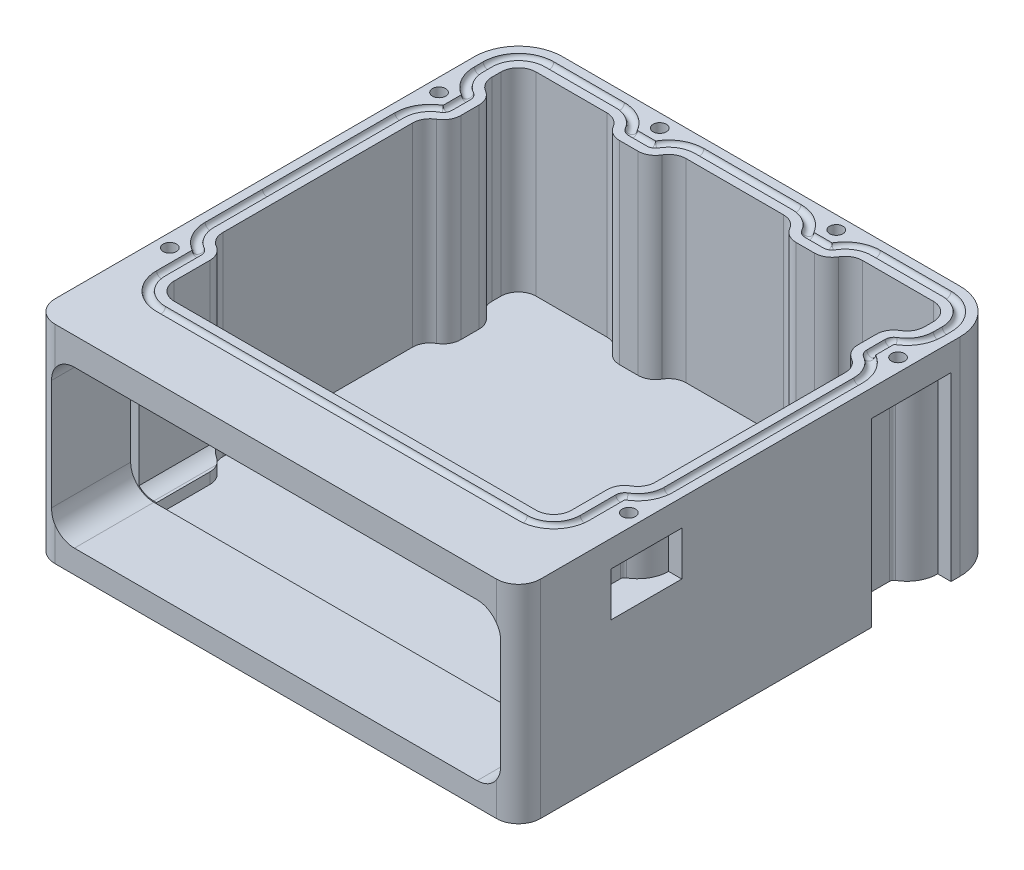
from build123d import *

# Parameters (mm, degrees)
EXTRUDE_THIN1_DEPTH      = 20
EXTRUDE_THIN1_DEPTH_BACK = 27
BOSS_EXTRUDE1_DEPTH      = 3
SKETCH4_W                = 104
SKETCH4_H                = 47
BOSS_EXTRUDE2_DEPTH      = 12
CUT_EXTRUDE1_DEPTH       = 18
SKETCH5_W                = 4
SKETCH5_H                = 15
SKETCH5_H_2              = 10
SKETCH5_W_2              = 10
SKETCH5_H_3              = 4
BOSS_EXTRUDE3_DEPTH      = 44
FILLET1_R                = 4
FILLET2_R                = 4
CUT_EXTRUDE2_DEPTH       = 10
SKETCH11_R               = 1.5
CUT_EXTRUDE3_DEPTH       = 231.447391
CUT_EXTRUDE6_REACH       = 230.88
SKETCH12_R               = 2.75
BOSS_EXTRUDE4_DEPTH      = 3
CUT_EXTRUDE4_START       = -18.9999
CUT_EXTRUDE4_DEPTH       = 18.9999
SKETCH6_R                = 1


with BuildPart() as part:
    # Sketch1 → Extrude-Thin1 (new, two sides: drawn at the far end of the back side and taken through both)
    with BuildSketch(Plane(origin=(0, 0, 0), x_dir=(1, 0, 0), z_dir=(0, 1, 0)).offset(-EXTRUDE_THIN1_DEPTH_BACK)):
        with BuildLine():
            Line((-55, 115), (-55, 210))
            ThreePointArc((-55, 210), (-52.071068, 217.071068), (-45, 220))
            Line((-45, 220), (45, 220))
            ThreePointArc((45, 220), (52.071068, 217.071068), (55, 210))
            Line((55, 210), (55, 115))
            ThreePointArc((55, 115), (53.535534, 111.464466), (50, 110))
            Line((50, 110), (-50, 110))
            ThreePointArc((-50, 110), (-53.535534, 111.464466), (-55, 115))
        make_face()
        with BuildLine():
            Line((-49, 116), (-49, 210))
            ThreePointArc((-49, 210), (-47.828427, 212.828427), (-45, 214))
            Line((-45, 214), (45, 214))
            ThreePointArc((45, 214), (47.828427, 212.828427), (49, 210))
            Line((49, 210), (49, 116))
            Line((49, 116), (-49, 116))
        make_face(mode=Mode.SUBTRACT)
    extrude(amount=EXTRUDE_THIN1_DEPTH + EXTRUDE_THIN1_DEPTH_BACK)

    # Sketch2 → Boss-Extrude1 (add)
    with BuildSketch(Plane.XZ.offset(27)):
        with BuildLine():
            Line((-49, -116), (49, -116))
            Line((49, -116), (49, -210))
            ThreePointArc((49, -210), (47.828427, -212.828427), (45, -214))
            Line((45, -214), (-45, -214))
            ThreePointArc((-45, -214), (-47.828427, -212.828427), (-49, -210))
            Line((-49, -210), (-49, -116))
        make_face()
    extrude(amount=-BOSS_EXTRUDE1_DEPTH)

    # Sketch4 → Boss-Extrude2 (add)
    with BuildSketch(Plane(origin=(0, 0, -116), x_dir=(-1, 0, 0), z_dir=(0, 0, -1))):
        with Locations((0, -3.5)):
            Rectangle(SKETCH4_W, SKETCH4_H)
    extrude(amount=BOSS_EXTRUDE2_DEPTH)

    # Sketch3 → Cut-Extrude1 (cut)
    with BuildSketch(Plane.XY.offset(-110)):
        with BuildLine():
            Line((-45.625, 13.75), (45.625, 13.75))
            ThreePointArc((45.625, 13.75), (49.337311, 12.212311), (50.875, 8.5))
            Line((50.875, 8.5), (50.875, -16.5))
            ThreePointArc((50.875, -16.5), (49.337311, -20.212311), (45.625, -21.75))
            Line((45.625, -21.75), (-45.625, -21.75))
            ThreePointArc((-45.625, -21.75), (-49.337311, -20.212311), (-50.875, -16.5))
            Line((-50.875, -16.5), (-50.875, 8.5))
            ThreePointArc((-50.875, 8.5), (-49.337311, 12.212311), (-45.625, 13.75))
        make_face()
    extrude(amount=-CUT_EXTRUDE1_DEPTH, mode=Mode.SUBTRACT)

    # Sketch5 → Boss-Extrude3 (add)
    with BuildSketch(Plane(origin=(0, -24, 0), x_dir=(1, 0, 0), z_dir=(0, 1, 0))):
        with Locations((47, 135.5)):
            Rectangle(SKETCH5_W, SKETCH5_H)
        with Locations((47, 199)):
            Rectangle(SKETCH5_W, SKETCH5_H_2)
        with Locations((20, 212)):
            Rectangle(SKETCH5_W_2, SKETCH5_H_3)
        with Locations((-20, 212)):
            Rectangle(SKETCH5_W_2, SKETCH5_H_3)
        with Locations((-47, 199)):
            Rectangle(SKETCH5_W, SKETCH5_H_2)
        with Locations((-47, 135.5)):
            Rectangle(SKETCH5_W, SKETCH5_H)
    extrude(amount=BOSS_EXTRUDE3_DEPTH)

    # Fillet1
    fillet1_edges = [part.edges().sort_by_distance(p)[0] for p in [
        (49, -2, -194),
        (49, -2, -204),
        (25, -2, -214),
        (15, -2, -214),
        (-15, -2, -214),
        (-25, -2, -214),
        (-49, -2, -204),
        (-49, -2, -194),
        (49, -2, -143),
        (-49, -2, -143),
    ]]
    fillet(fillet1_edges, radius=FILLET1_R - 0.0001)  # a hair under: the kernel refuses the full size

    # Fillet2
    fillet2_edges = [part.edges().sort_by_distance(p)[0] for p in [
        (45, 16.875, -128),
        (45, -2, -143),
        (45, -2, -194),
        (45, -2, -204),
        (25, -2, -210),
        (15, -2, -210),
        (-15, -2, -210),
        (-25, -2, -210),
        (-45, -2, -194),
        (-45, -2, -204),
        (-45, 16.875, -128),
        (-45, -2, -143),
    ]]
    fillet(fillet2_edges, radius=FILLET2_R)

    # Sketch10 → Cut-Extrude2 (cut)
    with BuildSketch(Plane(origin=(0, 14, 0), x_dir=(1, 0, 0), z_dir=(0, 1, 0))):
        with BuildLine():
            Line((-52, 147), (-55, 147))
            Line((-55, 147), (-55, 131))
            Line((-55, 131), (-50.5, 131))
            ThreePointArc((-50.5, 131), (-48.732233, 131.732233), (-48, 133.5))
            Line((-48, 133.5), (-48, 140.071797))
            ThreePointArc((-48, 140.071797), (-48.133975, 140.571797), (-48.5, 140.937822))
            ThreePointArc((-48.5, 140.937822), (-51.062178, 143.5), (-52, 147))
        make_face()
        with BuildLine():
            Line((52, 208), (55, 208))
            Line((55, 208), (55, 190))
            Line((55, 190), (52, 190))
            ThreePointArc((52, 190), (51.062178, 193.5), (48.5, 196.062178))
            ThreePointArc((48.5, 196.062178), (48.133975, 196.428203), (48, 196.928203))
            Line((48, 196.928203), (48, 201.071797))
            ThreePointArc((48, 201.071797), (48.133975, 201.571797), (48.5, 201.937822))
            ThreePointArc((48.5, 201.937822), (51.062178, 204.5), (52, 208))
        make_face()
        with BuildLine():
            Line((-29, 220), (-29, 217))
            ThreePointArc((-29, 217), (-25.5, 216.062178), (-22.937822, 213.5))
            ThreePointArc((-22.937822, 213.5), (-22.571797, 213.133975), (-22.071797, 213))
            Line((-22.071797, 213), (-17.928203, 213))
            ThreePointArc((-17.928203, 213), (-17.428203, 213.133975), (-17.062178, 213.5))
            ThreePointArc((-17.062178, 213.5), (-14.5, 216.062178), (-11, 217))
            Line((-11, 217), (-11, 220))
            Line((-11, 220), (-29, 220))
        make_face()
        with BuildLine():
            Line((-52, 208), (-55, 208))
            Line((-55, 208), (-55, 190))
            Line((-55, 190), (-52, 190))
            ThreePointArc((-52, 190), (-51.062178, 193.5), (-48.5, 196.062178))
            ThreePointArc((-48.5, 196.062178), (-48.133975, 196.428203), (-48, 196.928203))
            Line((-48, 196.928203), (-48, 201.071797))
            ThreePointArc((-48, 201.071797), (-48.133975, 201.571797), (-48.5, 201.937822))
            ThreePointArc((-48.5, 201.937822), (-51.062178, 204.5), (-52, 208))
        make_face()
        with BuildLine():
            Line((11, 220), (29, 220))
            Line((29, 220), (29, 217))
            ThreePointArc((29, 217), (25.5, 216.062178), (22.937822, 213.5))
            ThreePointArc((22.937822, 213.5), (22.571797, 213.133975), (22.071797, 213))
            Line((22.071797, 213), (17.928203, 213))
            ThreePointArc((17.928203, 213), (17.428203, 213.133975), (17.062178, 213.5))
            ThreePointArc((17.062178, 213.5), (14.5, 216.062178), (11, 217))
            Line((11, 217), (11, 220))
        make_face()
        with BuildLine():
            Line((48, 140.071797), (48, 133.5))
            ThreePointArc((48, 133.5), (48.732233, 131.732233), (50.5, 131))
            Line((50.5, 131), (55, 131))
            Line((55, 131), (55, 147))
            Line((55, 147), (52, 147))
            ThreePointArc((52, 147), (51.062178, 143.5), (48.5, 140.937822))
            ThreePointArc((48.5, 140.937822), (48.133975, 140.571797), (48, 140.071797))
        make_face()
    extrude(amount=-CUT_EXTRUDE2_DEPTH, mode=Mode.SUBTRACT)

    # Sketch11 → Cut-Extrude3 (cut, through all)
    with BuildSketch(Plane.XZ.offset(-14)):
        with Locations(Location((-52, -199, 0), (0, 0, 270))):
            Circle(SKETCH11_R)
        with Locations(Location((-20, -217.00298, 0), (0, 0, 270))):
            Circle(SKETCH11_R)
        with Locations(Location((20, -217.00298, 0), (0, 0, 270))):
            Circle(SKETCH11_R)
        with Locations(Location((52, -199, 0), (0, 0, 270))):
            Circle(SKETCH11_R)
        with Locations(Location((52, -138, 0), (0, 0, 270))):
            Circle(SKETCH11_R)
        with Locations(Location((-52, -138, 0), (0, 0, 270))):
            Circle(SKETCH11_R)
    extrude(amount=-CUT_EXTRUDE3_DEPTH, mode=Mode.SUBTRACT)

    # Sketch15 → Cut-Extrude6 (cut, up to next)
    with BuildSketch(Plane(origin=(0, 4, 0), x_dir=(1, 0, 0), z_dir=(0, 1, 0)), mode=Mode.PRIVATE) as cut_extrude6_sk1:
        with BuildLine():
            Line((-55, 208), (-55, 190))
            Line((-55, 190), (-52, 190))
            ThreePointArc((-52, 190), (-51.062178, 193.5), (-48.5, 196.062178))
            ThreePointArc((-48.5, 196.062178), (-48.133975, 196.428203), (-48, 196.928203))
            Line((-48, 196.928203), (-48, 201.071797))
            ThreePointArc((-48, 201.071797), (-48.133975, 201.571797), (-48.5, 201.937822))
            ThreePointArc((-48.5, 201.937822), (-51.062178, 204.5), (-52, 208))
            Line((-52, 208), (-55, 208))
        make_face()
    cut_extrude6_tool1 = extrude(cut_extrude6_sk1.sketch, amount=-CUT_EXTRUDE6_REACH, mode=Mode.PRIVATE) & part.part
    # Sketch15 → Cut-Extrude6 (cut, up to next)
    with BuildSketch(Plane(origin=(0, 4, 0), x_dir=(1, 0, 0), z_dir=(0, 1, 0)), mode=Mode.PRIVATE) as cut_extrude6_sk2:
        with BuildLine():
            Line((-11, 220), (-29, 220))
            Line((-29, 220), (-29, 217))
            ThreePointArc((-29, 217), (-25.5, 216.062178), (-22.937822, 213.5))
            ThreePointArc((-22.937822, 213.5), (-22.571797, 213.133975), (-22.071797, 213))
            Line((-22.071797, 213), (-17.928203, 213))
            ThreePointArc((-17.928203, 213), (-17.428203, 213.133975), (-17.062178, 213.5))
            ThreePointArc((-17.062178, 213.5), (-14.5, 216.062178), (-11, 217))
            Line((-11, 217), (-11, 220))
        make_face()
    cut_extrude6_tool2 = extrude(cut_extrude6_sk2.sketch, amount=-CUT_EXTRUDE6_REACH, mode=Mode.PRIVATE) & part.part
    # Sketch15 → Cut-Extrude6 (cut, up to next)
    with BuildSketch(Plane(origin=(0, 4, 0), x_dir=(1, 0, 0), z_dir=(0, 1, 0)), mode=Mode.PRIVATE) as cut_extrude6_sk3:
        with BuildLine():
            Line((29, 217), (29, 220))
            Line((29, 220), (11, 220))
            Line((11, 220), (11, 217))
            ThreePointArc((11, 217), (14.5, 216.062178), (17.062178, 213.5))
            ThreePointArc((17.062178, 213.5), (17.428203, 213.133975), (17.928203, 213))
            Line((17.928203, 213), (22.071797, 213))
            ThreePointArc((22.071797, 213), (22.571797, 213.133975), (22.937822, 213.5))
            ThreePointArc((22.937822, 213.5), (25.5, 216.062178), (29, 217))
        make_face()
    cut_extrude6_tool3 = extrude(cut_extrude6_sk3.sketch, amount=-CUT_EXTRUDE6_REACH, mode=Mode.PRIVATE) & part.part
    # Sketch15 → Cut-Extrude6 (cut, up to next)
    with BuildSketch(Plane(origin=(0, 4, 0), x_dir=(1, 0, 0), z_dir=(0, 1, 0)), mode=Mode.PRIVATE) as cut_extrude6_sk4:
        with BuildLine():
            Line((55, 190), (55, 208))
            Line((55, 208), (52, 208))
            ThreePointArc((52, 208), (51.062178, 204.5), (48.5, 201.937822))
            ThreePointArc((48.5, 201.937822), (48.133975, 201.571797), (48, 201.071797))
            Line((48, 201.071797), (48, 196.928203))
            ThreePointArc((48, 196.928203), (48.133975, 196.428203), (48.5, 196.062178))
            ThreePointArc((48.5, 196.062178), (51.062178, 193.5), (52, 190))
            Line((52, 190), (55, 190))
        make_face()
    cut_extrude6_tool4 = extrude(cut_extrude6_sk4.sketch, amount=-CUT_EXTRUDE6_REACH, mode=Mode.PRIVATE) & part.part
    add(cut_extrude6_tool1.solids().sort_by_distance((-52.255017, 4, -199))[0], mode=Mode.SUBTRACT)
    add(cut_extrude6_tool2.solids().sort_by_distance((-20, 4, -217.255017))[0], mode=Mode.SUBTRACT)
    add(cut_extrude6_tool3.solids().sort_by_distance((20, 4, -217.255017))[0], mode=Mode.SUBTRACT)
    add(cut_extrude6_tool4.solids().sort_by_distance((52.255017, 4, -199))[0], mode=Mode.SUBTRACT)

    # Sketch12 → Boss-Extrude4 (add)
    with BuildSketch(Plane.XZ.offset(27)):
        with BuildLine():
            Line((-12, -110), (12, -110))
            Line((12, -110), (12, -232))
            ThreePointArc((12, -232), (0, -244), (-12, -232))
            Line((-12, -232), (-12, -110))
        make_face()
        with Locations(Location((0, -232, 0), (0, 0, 270))):
            Circle(SKETCH12_R, mode=Mode.SUBTRACT)
    extrude(amount=-BOSS_EXTRUDE4_DEPTH)

    # Sketch13 → Cut-Extrude4 (cut)
    with BuildSketch(Plane.XY.offset(-128).offset(CUT_EXTRUDE4_START)):
        with BuildLine():
            Line((-45, 13.5), (-45, 0))
            Line((-45, 0), (-49, 0))
            Line((-49, 0), (-49, -20.189089))
            ThreePointArc((-49, -20.189089), (-47.435325, -21.160764), (-45.625, -21.5))
            Line((-45.625, -21.5), (45.625, -21.5))
            ThreePointArc((45.625, -21.5), (47.435325, -21.160764), (49, -20.189089))
            Line((49, -20.189089), (49, 0))
            Line((49, 0), (45, 0))
            Line((45, 0), (45, 13.5))
            Line((45, 13.5), (-45, 13.5))
        make_face()
    extrude(amount=CUT_EXTRUDE4_DEPTH, mode=Mode.SUBTRACT)

    # Cut-Sweep2: sweep along a path in Sketch9
    with BuildLine(Plane(origin=(0, 20, 0), x_dir=(1, 0, 0), z_dir=(0, 1, 0))) as cut_sweep2_path:
        Line((-17.928203, 213), (-22.071797, 213))
        ThreePointArc((-22.071797, 213), (-22.571797, 213.133975), (-22.937822, 213.5))
        ThreePointArc((-22.937822, 213.5), (-25.5, 216.062178), (-29, 217))
        Line((-29, 217), (-45, 217))
        ThreePointArc((-45, 217), (-49.949747, 214.949747), (-52, 210))
        Line((-52, 210), (-52, 208))
        ThreePointArc((-52, 208), (-51.062178, 204.5), (-48.5, 201.937822))
        ThreePointArc((-48.5, 201.937822), (-48.133975, 201.571797), (-48, 201.071797))
        Line((-48, 201.071797), (-48, 196.928203))
        ThreePointArc((-48, 196.928203), (-48.133975, 196.428203), (-48.5, 196.062178))
        ThreePointArc((-48.5, 196.062178), (-51.062178, 193.5), (-52, 190))
        Line((-52, 190), (-52, 147))
        ThreePointArc((-52, 147), (-51.062178, 143.5), (-48.5, 140.937822))
        ThreePointArc((-48.5, 140.937822), (-48.133975, 140.571797), (-48, 140.071797))
        Line((-48, 140.071797), (-48, 132))
        ThreePointArc((-48, 132), (-45.949747, 127.050253), (-41, 125))
        Line((-41, 125), (41, 125))
        ThreePointArc((41, 125), (45.949747, 127.050253), (48, 132))
        Line((48, 132), (48, 140.071797))
        ThreePointArc((48, 140.071797), (48.133975, 140.571797), (48.5, 140.937822))
        ThreePointArc((48.5, 140.937822), (51.062178, 143.5), (52, 147))
        Line((52, 147), (52, 190))
        ThreePointArc((52, 190), (51.062178, 193.5), (48.5, 196.062178))
        ThreePointArc((48.5, 196.062178), (48.133975, 196.428203), (48, 196.928203))
        Line((48, 196.928203), (48, 201.071797))
        ThreePointArc((48, 201.071797), (48.133975, 201.571797), (48.5, 201.937822))
        ThreePointArc((48.5, 201.937822), (51.062178, 204.5), (52, 208))
        Line((52, 208), (52, 210))
        ThreePointArc((52, 210), (49.949747, 214.949747), (45, 217))
        Line((45, 217), (29, 217))
        ThreePointArc((29, 217), (25.5, 216.062178), (22.937822, 213.5))
        ThreePointArc((22.937822, 213.5), (22.571797, 213.133975), (22.071797, 213))
        Line((22.071797, 213), (17.928203, 213))
        ThreePointArc((17.928203, 213), (17.428203, 213.133975), (17.062178, 213.5))
        ThreePointArc((17.062178, 213.5), (14.5, 216.062178), (11, 217))
        Line((11, 217), (-11, 217))
        ThreePointArc((-11, 217), (-14.5, 216.062178), (-17.062178, 213.5))
        ThreePointArc((-17.062178, 213.5), (-17.428203, 213.133975), (-17.928203, 213))
    # Sketch6 → Cut-Sweep2 (sweep, cut)
    with BuildSketch(Plane.XY.offset(-160)):
        with Locations((-52, 20)):
            Circle(SKETCH6_R)
    sweep(path=cut_sweep2_path.line, mode=Mode.SUBTRACT)


solid = part.part
